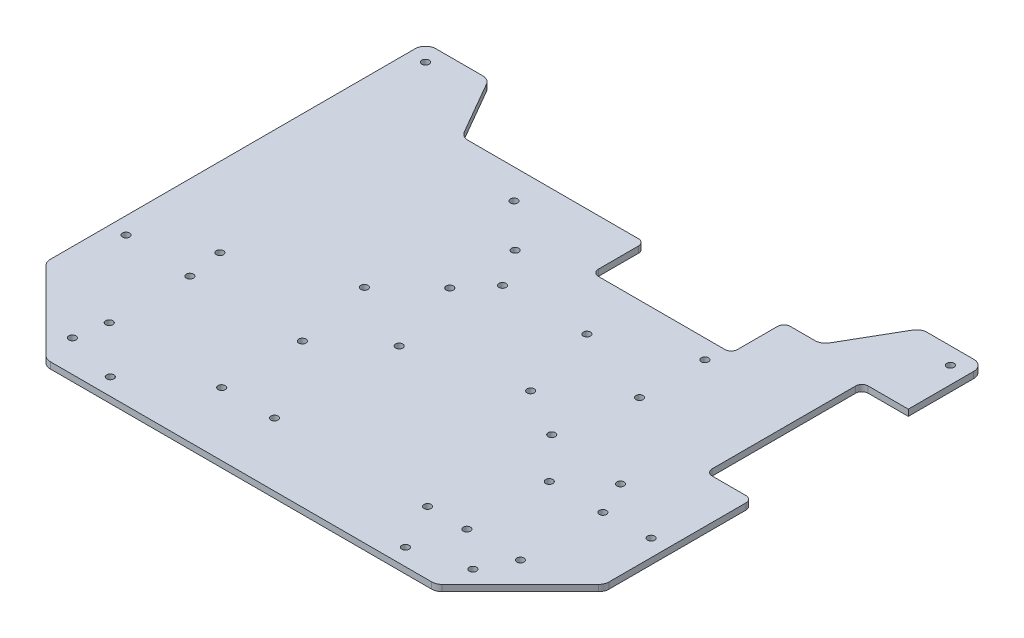
from build123d import *

# Parameters (mm, degrees)
BOSS_EXTRU_1_DEPTH           = 3
CONG_1_R                     = 5
ESQUISSE2_R                  = 1
ENL_V_MAT_EXTRU_1_DEPTH      = 3
D_GAGEMENT_M31_D             = 3.4
ESQUISSE5_W                  = 66
ESQUISSE5_H                  = 25
ESQUISSE5_W_2                = 22
ESQUISSE5_H_2                = 74
ENL_V_MAT_EXTRU_2_DEPTH      = 257.837010573
CONG_2_R                     = 3
ESQUISSE6_R                  = 1
ENL_V_MAT_EXTRU_3_DEPTH      = 257.837010573
D_GAGEMENT_M32_D             = 3.4
D_GAGEMENT_M32_DEPTH         = 10
D_GAGEMENT_M32_TIP           = 1.021463052
ESQUISSE9_R                  = 1
ENL_V_MAT_EXTRU_4_DEPTH      = 257.837010573
D_GAGEMENT_M33_D             = 3.4
D_GAGEMENT_M33_DEPTH         = 10
D_GAGEMENT_M33_TIP           = 1.021463052
ENL_V_MAT_EXTRU_5_DEPTH      = 257.837010573
ENL_V_MAT_EXTRU_5_DEPTH_BACK = 257.837010573
ESQUISSE12_R                 = 1
D_GAGEMENT_M34_D             = 3.4
D_GAGEMENT_M34_DEPTH         = 10
D_GAGEMENT_M34_TIP           = 1.021463052
D_GAGEMENT_M35_D             = 3.4
D_GAGEMENT_M35_DEPTH         = 10
D_GAGEMENT_M35_TIP           = 1.021463052


with BuildPart() as part:
    # Esquisse1 → Boss.-Extru.1 (new body)
    with BuildSketch(Plane(origin=(0, 0, 0), x_dir=(1, 0, 0), z_dir=(0, 1, 0))):
        Polygon((-92.5, 0), (92.5, 0), (132.5, 40), (132.5, 220), (102.5, 220), (85.179491924, 190), (-85.179491924, 190), (-102.5, 220), (-132.5, 220), (-132.5, 40), align=None)
    extrude(amount=BOSS_EXTRU_1_DEPTH)

    # Congé1
    cong_1_edges = [part.edges().sort_by_distance(p)[0] for p in [
        (92.5, 1.5, 0),
        (132.5, 1.5, -40),
        (132.5, 1.5, -220),
        (102.5, 1.5, -220),
        (85.179491924, 1.5, -190),
        (-85.179491924, 1.5, -190),
        (-102.5, 1.5, -220),
        (-132.5, 1.5, -220),
        (-92.5, 1.5, 0),
        (-132.5, 1.5, -40),
    ]]
    fillet(cong_1_edges, radius=CONG_1_R)

    # Esquisse2 → Enlèv. mat.-Extru.1 (cut)
    with BuildSketch(Plane(origin=(0, 3, 0), x_dir=(1, 0, 0), z_dir=(0, 1, 0))):
        with Locations((70, 8)):
            Circle(ESQUISSE2_R)
        with Locations((124.5, 70)):
            Circle(ESQUISSE2_R)
        with Locations((124.5, 212)):
            Circle(ESQUISSE2_R)
        with Locations((-124.5, 212)):
            Circle(ESQUISSE2_R)
        with Locations((-124.5, 70)):
            Circle(ESQUISSE2_R)
        with Locations((-70, 8)):
            Circle(ESQUISSE2_R)
    extrude(amount=-ENL_V_MAT_EXTRU_1_DEPTH, mode=Mode.SUBTRACT)

    # Dégagement M31 (through all)
    with Locations(Plane(origin=(0, 3, 0), x_dir=(1, 0, 0), z_dir=(0, 1, 0))):
        with Locations((70, 8), (-70, 8), (-124.5, 70), (-124.5, 212), (124.5, 212), (124.5, 70)):
            Hole(D_GAGEMENT_M31_D / 2)

    # Esquisse5 → Enlèv. mat.-Extru.2 (cut, through all)
    with BuildSketch(Plane(origin=(0, 3, 0), x_dir=(1, 0, 0), z_dir=(0, 1, 0))):
        with Locations((34.5, 177.5)):
            Rectangle(ESQUISSE5_W, ESQUISSE5_H)
        with Locations((121.5, 147)):
            Rectangle(ESQUISSE5_W_2, ESQUISSE5_H_2)
    extrude(amount=-ENL_V_MAT_EXTRU_2_DEPTH, mode=Mode.SUBTRACT)

    # Congé2
    cong_2_edges = [part.edges().sort_by_distance(p)[0] for p in [
        (132.5, 1.5, -110),
        (110.5, 1.5, -110),
        (110.5, 1.5, -184),
        (67.5, 1.5, -190),
        (67.5, 1.5, -165),
        (1.5, 1.5, -165),
        (1.5, 1.5, -190),
    ]]
    fillet(cong_2_edges, radius=CONG_2_R)

    # Esquisse6 → Enlèv. mat.-Extru.3 (cut, through all)
    with BuildSketch(Plane(origin=(0, 3, 0), x_dir=(1, 0, 0), z_dir=(0, 1, 0))):
        with Locations((64, 156)):
            Circle(ESQUISSE6_R)
        with Locations((-26, 156)):
            Circle(ESQUISSE6_R)
        with Locations((-46.5, 176)):
            Circle(ESQUISSE6_R)
        with Locations((64, 125)):
            Circle(ESQUISSE6_R)
        with Locations((-26, 125)):
            Circle(ESQUISSE6_R)
        with Locations((-46.5, 105)):
            Circle(ESQUISSE6_R)
    extrude(amount=-ENL_V_MAT_EXTRU_3_DEPTH, mode=Mode.SUBTRACT)

    # Dégagement M32
    with Locations(Plane(origin=(0, 3, 0), x_dir=(1, 0, 0), z_dir=(0, 1, 0))):
        with Locations((-46.5, 105), (-26, 125), (-26, 156), (-46.5, 176), (64, 156), (64, 125)):
            Hole(D_GAGEMENT_M32_D / 2, depth=D_GAGEMENT_M32_DEPTH)
            with Locations((0, 0, -(D_GAGEMENT_M32_DEPTH + D_GAGEMENT_M32_TIP / 2))):  # 118° drill point
                Cone(0, D_GAGEMENT_M32_D / 2, D_GAGEMENT_M32_TIP, mode=Mode.SUBTRACT)

    # Esquisse9 → Enlèv. mat.-Extru.4 (cut, through all)
    with BuildSketch(Plane(origin=(0, 3, 0), x_dir=(1, 0, 0), z_dir=(0, 1, 0))):
        with Locations((102.5, 30)):
            Circle(ESQUISSE9_R)
        with Locations((77.1, 30)):
            Circle(ESQUISSE9_R)
        with Locations((77.1, 69.12)):
            Circle(ESQUISSE9_R)
        with Locations((102.5, 69.12)):
            Circle(ESQUISSE9_R)
        with Locations((-92.5, 68.24)):
            Circle(ESQUISSE9_R)
        with Locations((-39.16, 68.24)):
            Circle(ESQUISSE9_R)
        with Locations((-39.16, 30)):
            Circle(ESQUISSE9_R)
        with Locations((-92.5, 30)):
            Circle(ESQUISSE9_R)
        with Locations((-14.16, 89.182)):
            Circle(ESQUISSE9_R)
        with Locations((58.445555666, 88.92798746)):
            Circle(ESQUISSE9_R)
        with Locations((-14.16, 30)):
            Circle(ESQUISSE9_R)
        with Locations((58.484, 30)):
            Circle(ESQUISSE9_R)
        with Locations((-14.554444334, 138.588593019)):
            Circle(ESQUISSE9_R)
        with Locations((25.445555666, 138.588593019)):
            Circle(ESQUISSE9_R)
        with Locations((35.445555666, 101.92798746)):
            Circle(ESQUISSE9_R)
    extrude(amount=-ENL_V_MAT_EXTRU_4_DEPTH, mode=Mode.SUBTRACT)

    # Dégagement M33
    with Locations(Plane(origin=(0, 3, 0), x_dir=(1, 0, 0), z_dir=(0, 1, 0))):
        with Locations((77.1, 30), (102.5, 30), (77.1, 69.12), (102.5, 69.12)):
            Hole(D_GAGEMENT_M33_D / 2, depth=D_GAGEMENT_M33_DEPTH)
            with Locations((0, 0, -(D_GAGEMENT_M33_DEPTH + D_GAGEMENT_M33_TIP / 2))):  # 118° drill point
                Cone(0, D_GAGEMENT_M33_D / 2, D_GAGEMENT_M33_TIP, mode=Mode.SUBTRACT)

    # Esquisse12 → Enlèv. mat.-Extru.5 (cut, two sides: drawn at the far end of the back side and taken through both)
    with BuildSketch(Plane(origin=(0, 3, 0), x_dir=(1, 0, 0), z_dir=(0, 1, 0)).offset(-ENL_V_MAT_EXTRU_5_DEPTH_BACK)):
        with Locations((-95, 85)):
            Circle(ESQUISSE12_R)
        with Locations((95, 85)):
            Circle(ESQUISSE12_R)
        with Locations((95, 15)):
            Circle(ESQUISSE12_R)
        with Locations((-95, 15)):
            Circle(ESQUISSE12_R)
    extrude(amount=ENL_V_MAT_EXTRU_5_DEPTH + ENL_V_MAT_EXTRU_5_DEPTH_BACK, mode=Mode.SUBTRACT)

    # Dégagement M34
    with Locations(Plane(origin=(0, 3, 0), x_dir=(1, 0, 0), z_dir=(0, 1, 0))):
        with Locations((-92.5, 68.24), (-92.5, 30), (-39.16, 30), (-39.16, 68.24), (-14.16, 30), (58.484, 30), (-14.16, 89.182), (58.445555666, 88.92798746), (35.445555666, 101.92798746), (25.445555666, 138.588593019), (-14.554444334, 138.588593019)):
            Hole(D_GAGEMENT_M34_D / 2, depth=D_GAGEMENT_M34_DEPTH)
            with Locations((0, 0, -(D_GAGEMENT_M34_DEPTH + D_GAGEMENT_M34_TIP / 2))):  # 118° drill point
                Cone(0, D_GAGEMENT_M34_D / 2, D_GAGEMENT_M34_TIP, mode=Mode.SUBTRACT)

    # Dégagement M35
    with Locations(Plane(origin=(0, 3, 0), x_dir=(1, 0, 0), z_dir=(0, 1, 0))):
        with Locations((-95, 15), (-95, 85), (95, 85), (95, 15)):
            Hole(D_GAGEMENT_M35_D / 2, depth=D_GAGEMENT_M35_DEPTH)
            with Locations((0, 0, -(D_GAGEMENT_M35_DEPTH + D_GAGEMENT_M35_TIP / 2))):  # 118° drill point
                Cone(0, D_GAGEMENT_M35_D / 2, D_GAGEMENT_M35_TIP, mode=Mode.SUBTRACT)


solid = part.part
